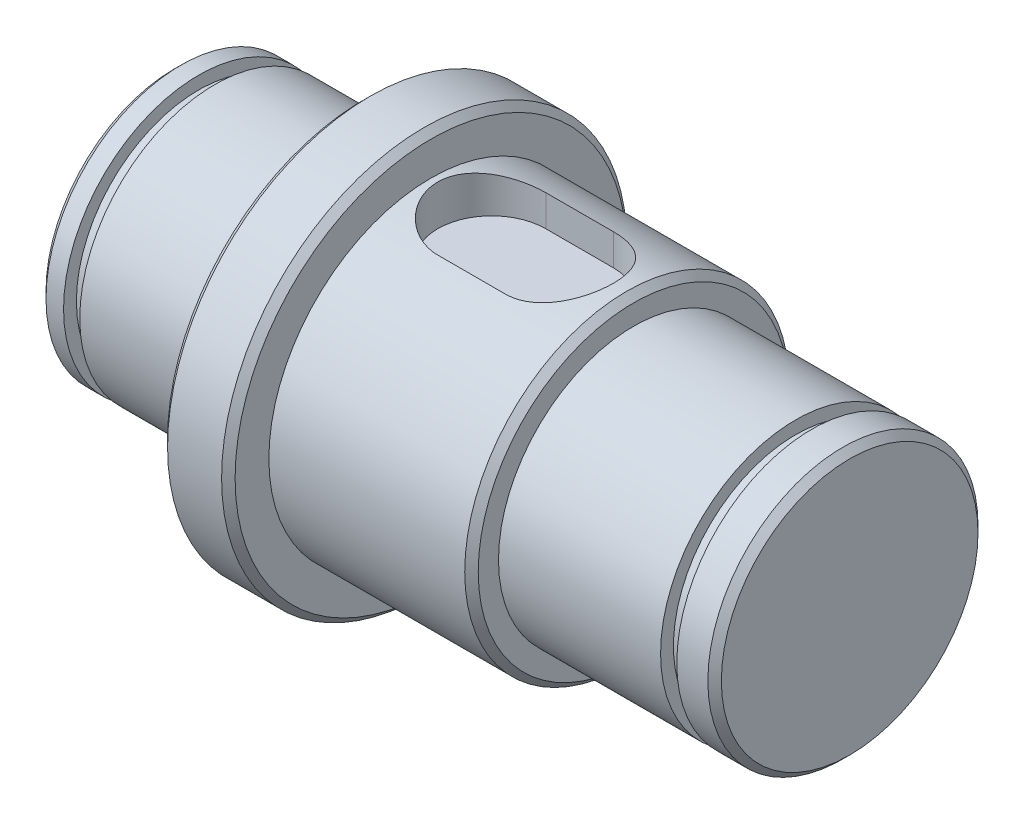
from build123d import *

# Parameters (mm, degrees)
SCHIZZO2_R               = 10
SCHIZZO2_R_2             = 9.05
TAGLIO_ESTRUSIONE1_DEPTH = 1.2
TAGLIO_ESTRUSIONE2_START = -1.2
SCHIZZO3_R               = 10
SCHIZZO3_R_2             = 9.05
TAGLIO_ESTRUSIONE2_DEPTH = 1.2
SMUSSO1_SIZE             = 0.5
TAGLIO_ESTRUSIONE5_START = 9
TAGLIO_ESTRUSIONE5_DEPTH = 3.0000001


with BuildPart() as part:
    # Schizzo1 → Rivoluzione1 (revolve)
    with BuildSketch(Plane.XY, mode=Mode.PRIVATE) as rivoluzione1_sk:
        Polygon((-25, 0), (25, 0), (25, -10), (9, -10), (9, -12), (-6, -12), (-6, -15), (-11, -15), (-11, -10), (-25, -10), align=None)
    revolve(rivoluzione1_sk.sketch.rotate(Axis((-25, 0, 0), (1, 0, 0)), 270), axis=Axis((-25, 0, 0), (1, 0, 0)))

    # Schizzo2 → Taglio-Estrusione1 (cut)
    with BuildSketch(Plane.ZY.offset(23.2)):
        Circle(SCHIZZO2_R)
        Circle(SCHIZZO2_R_2, mode=Mode.SUBTRACT)
    extrude(amount=-TAGLIO_ESTRUSIONE1_DEPTH, mode=Mode.SUBTRACT)

    # Schizzo3 → Taglio-Estrusione2 (cut)
    with BuildSketch(Plane(origin=(22.2, 0, 0), x_dir=(0, 0, -1), z_dir=(1, 0, 0)).offset(TAGLIO_ESTRUSIONE2_START)):
        with Locations(Location((0, 0, 0), (0, 0, 180))):
            Circle(SCHIZZO3_R)
        with Locations(Location((0, 0, 0), (0, 0, 180))):
            Circle(SCHIZZO3_R_2, mode=Mode.SUBTRACT)
    extrude(amount=TAGLIO_ESTRUSIONE2_DEPTH, mode=Mode.SUBTRACT)

    # Smusso1
    smusso1_edges = [part.edges().sort_by_distance(p)[0] for p in [
        (-6, 0, -15),
        (-11, 0, -15),
        (-25, 0, -10),
        (25, 0, -10),
        (9, 0, -12),
    ]]
    chamfer(smusso1_edges, length=SMUSSO1_SIZE)

    # Taglio-Estrusione5: read off the stored shape, not the designer's step
    # Taglio-Estrusione5 outline → Taglio-Estrusione5 (cut)
    with BuildSketch(Plane(origin=(0, 0, 0), x_dir=(1, 0, 0), z_dir=(0, 1, 0)).offset(TAGLIO_ESTRUSIONE5_START)):
        with BuildLine():
            Line((3.5, 4), (-1.5, 4))
            ThreePointArc((-1.5, 4), (-5.5, 0), (-1.5, -4))
            Line((-1.5, -4), (3.5, -4))
            ThreePointArc((3.5, -4), (7.5, 0), (3.5, 4))
        make_face()
    extrude(amount=TAGLIO_ESTRUSIONE5_DEPTH, mode=Mode.SUBTRACT)


solid = part.part
